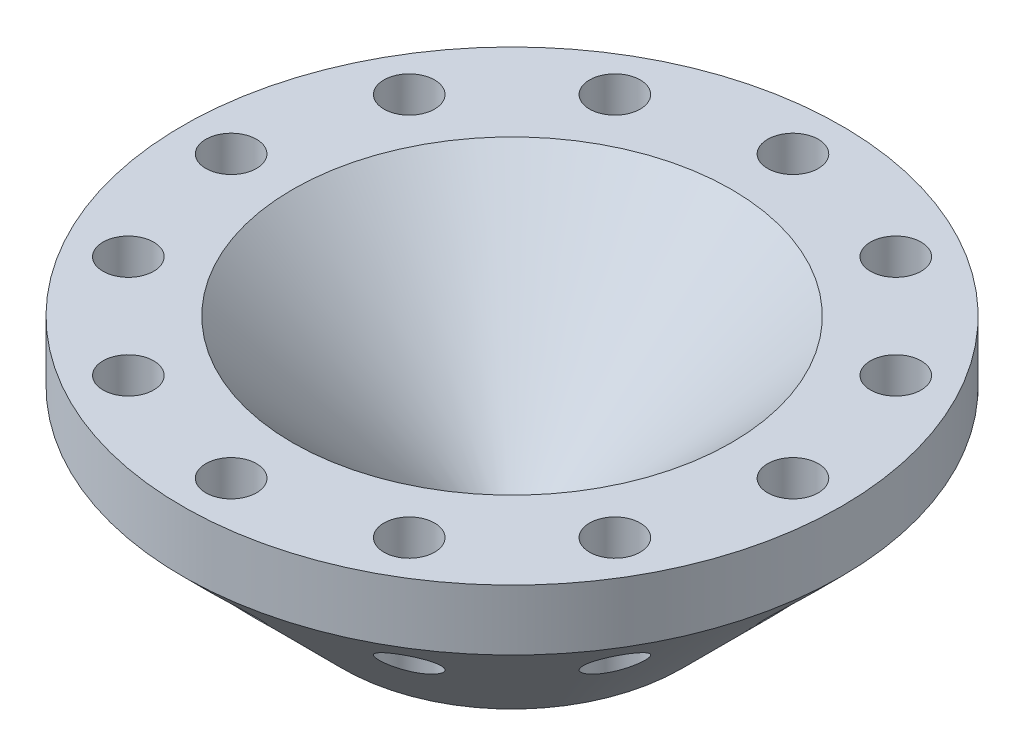
from build123d import *

# Parameters (mm, degrees)
CUT_EXTRUDE3_REACH = 48.798
SKETCH5_R          = 2.3
CIRPATTERN2_COUNT  = 12


with BuildPart() as part:
    # Sketch1 → Revolve1 (revolve)
    with BuildSketch(Plane.XY):
        Polygon((-19.917206338, 20), (-29.917206338, 20), (-29.917206338, 14.500914273), (-15.416292065, 0), (0, 0), (0, 0.082793662), align=None)
    revolve(axis=Axis((0, 0, 0), (0, 1, 0)))

    # Sketch5 → Cut-Extrude3 (cut, up to next)
    with BuildSketch(Plane(origin=(0, 20, 0), x_dir=(1, 0, 0), z_dir=(0, 1, 0)), mode=Mode.PRIVATE) as cut_extrude3_sk1:
        with Locations((25.5, 0)):
            Circle(SKETCH5_R)
    cut_extrude3_tool1 = extrude(cut_extrude3_sk1.sketch, amount=-CUT_EXTRUDE3_REACH, mode=Mode.PRIVATE) & part.part
    cut_extrude3 = cut_extrude3_tool1.solids().sort_by_distance((25.5, 20, 0))[0]
    add(cut_extrude3, mode=Mode.SUBTRACT)

    # CirPattern2: Cut-Extrude3 ×12 about axis
    cirpattern2_axis = Axis((0, 20, 0), (0, -1, 0))
    for i in range(1, CIRPATTERN2_COUNT):
        add(cut_extrude3.rotate(cirpattern2_axis, i * 360 / CIRPATTERN2_COUNT), mode=Mode.SUBTRACT)


solid = part.part
